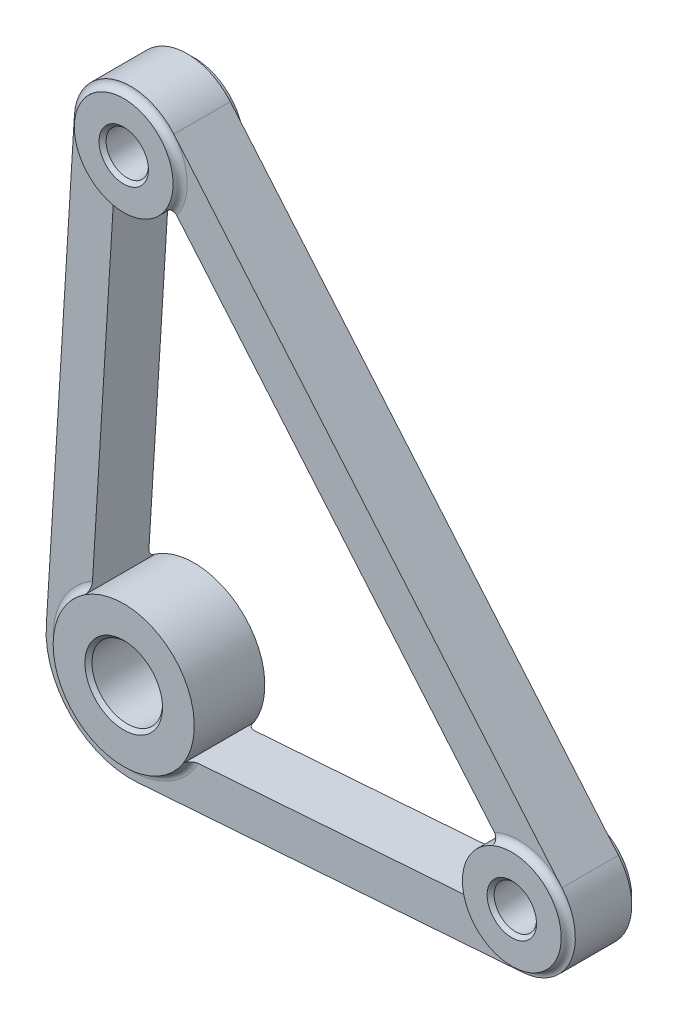
from build123d import *

# Parameters (mm, degrees)
BOSS_EXTRUDE1_DEPTH     = 4
SKETCH2_R               = 10
SKETCH2_R_2             = 7
BOSS_EXTRUDE2_DEPTH     = 1
CUT_EXTRUDE1_DEPTH      = 97.555683416
CUT_EXTRUDE1_DEPTH_BACK = 97.555683416
FILLET4_R               = 1
SKETCH7_R               = 7
SKETCH7_R_2             = 10
BOSS_EXTRUDE4_DEPTH     = 10
CUT_EXTRUDE2_DEPTH      = 97.845237373
CUT_EXTRUDE2_DEPTH_BACK = 97.845237373
SKETCH5_R               = 5
SKETCH5_R_2             = 3
FILLET5_R               = 1
CHAMFER1_SIZE           = 0.5


with BuildPart() as part:
    # Sketch1 → Boss-Extrude1 (new, symmetric)
    with BuildSketch(Plane.XY):
        with BuildLine():
            Line((-11.977256554, 0.738461538), (-7.984837703, 65.492307692))
            ThreePointArc((-7.984837703, 65.492307692), (-2.5191126, 72.593027835), (6.107090283, 70.167537932))
            Line((6.107090283, 70.167537932), (61.107090283, 5.167537932))
            ThreePointArc((61.107090283, 5.167537932), (62.375094743, -3.099673778), (55.581818182, -7.978814925))
            Line((55.581818182, -7.978814925), (0.872727273, -11.968222387))
            ThreePointArc((0.872727273, -11.968222387), (-8.437570547, -8.53272543), (-11.977256554, 0.738461538))
        make_face()
    extrude(amount=BOSS_EXTRUDE1_DEPTH, both=True)

    # Sketch2 → Boss-Extrude2 (add, symmetric)
    with BuildSketch(Plane.XY.offset(4)):
        Circle(SKETCH2_R)
        with Locations((0, 65)):
            Circle(SKETCH2_R_2)
        with Locations((55, 0)):
            Circle(SKETCH2_R_2)
    boss_extrude2 = extrude(amount=BOSS_EXTRUDE2_DEPTH, both=True)

    # Mirror4: Boss-Extrude2 across plane
    add(boss_extrude2.mirror(Plane.XY))

    # Sketch4 → Cut-Extrude1 (cut, two sides: drawn at the far end of the back side and taken through both)
    with BuildSketch(Plane.XY.offset(-CUT_EXTRUDE1_DEPTH_BACK)):
        with BuildLine():
            Line((0.436363636, -5.984111194), (55.145454545, -1.994703731))
            ThreePointArc((55.145454545, -1.994703731), (56.843773686, -0.774918445), (56.526772571, 1.291884483))
            Line((56.526772571, 1.291884483), (1.526772571, 66.291884483))
            ThreePointArc((1.526772571, 66.291884483), (-0.62977815, 66.898256959), (-1.996209426, 65.123076923))
            Line((-1.996209426, 65.123076923), (-5.988628277, 0.369230769))
            ThreePointArc((-5.988628277, 0.369230769), (-4.218785273, -4.266362715), (0.436363636, -5.984111194))
        make_face()
    extrude(amount=CUT_EXTRUDE1_DEPTH + CUT_EXTRUDE1_DEPTH_BACK, mode=Mode.SUBTRACT)

    # Fillet4
    fillet4_edges = [part.edges().sort_by_distance(p)[0] for p in [
        (51.800234692, -2.23863842, 5),
        (54.360216429, 3.852359924, 5),
        (51.800234692, -2.23863842, -5),
        (54.360216429, 3.852359924, -5),
        (-2.2026157, 61.775331943, 5),
        (-2.2026157, 61.775331943, -5),
        (-4.218785273, -4.266362715, 5),
        (-4.218785273, -4.266362715, -5),
        (56.843773686, -0.774918445, 5),
        (56.843773686, -0.774918445, -5),
        (-0.62977815, 66.898256959, 5),
        (-0.62977815, 66.898256959, -5),
        (-5.742474431, 4.361649621, 5),
        (4.425771099, -5.693202103, 5),
        (-5.742474431, 4.361649621, -5),
        (4.425771099, -5.693202103, -5),
        (3.693328713, 63.731409042, 5),
        (3.693328713, 63.731409042, -5),
    ]]
    fillet(fillet4_edges, radius=FILLET4_R)

    # Sketch7 → Boss-Extrude4 (add)
    with BuildSketch(Plane.XY.offset(5)):
        with Locations((0, 65)):
            Circle(SKETCH7_R)
        Circle(SKETCH7_R_2)
        with Locations((55, 0)):
            Circle(SKETCH7_R)
    extrude(amount=-BOSS_EXTRUDE4_DEPTH)

    # Sketch5 → Cut-Extrude2 (cut, two sides: drawn at the far end of the back side and taken through both)
    with BuildSketch(Plane.XY.offset(4).offset(-CUT_EXTRUDE2_DEPTH_BACK)):
        Circle(SKETCH5_R)
        with Locations((55, 0)):
            Circle(SKETCH5_R_2)
        with Locations((0, 65)):
            Circle(SKETCH5_R_2)
    extrude(amount=CUT_EXTRUDE2_DEPTH + CUT_EXTRUDE2_DEPTH_BACK, mode=Mode.SUBTRACT)

    # Fillet5
    # the kernel refuses this fillet: 1 mm, written as the material it adds along each edge
    with BuildSketch(Plane(origin=(0, 0, 4), x_dir=(-0.3253741437230861, 0.9455853565894877, 0), z_dir=(0.9455853565894877, 0.3253741437230861, 0))) as fillet5_piece_1_section:
        with BuildLine():
            CenterArc((10 + FILLET5_R, FILLET5_R), FILLET5_R, 180, 90)
            Line((10 + FILLET5_R, 0), (10, 0))
            Line((10, 0), (10, FILLET5_R))
        make_face()
    fillet5_piece_1 = revolve(axis=Axis((0, 0, 4), (0, 0, 1)), revolution_arc=232.666036755, mode=Mode.PRIVATE)
    fillet5_piece_1 = split(fillet5_piece_1, bisect_by=Plane(origin=(-5.920427429, 1.475394066, 4.281916241), z_dir=(-0.9981047128189905, 0.0615384615384615, 0)), keep=Keep.TOP, mode=Mode.PRIVATE)
    add(fillet5_piece_1)
    with BuildSketch(Plane(origin=(0, 0, 4), x_dir=(-0.3253741437230861, 0.9455853565894877, 0), z_dir=(0.9455853565894877, 0.3253741437230861, 0))) as fillet5_piece_2_section:
        with BuildLine():
            CenterArc((10 + FILLET5_R, FILLET5_R), FILLET5_R, 180, 90)
            Line((10 + FILLET5_R, 0), (10, 0))
            Line((10, 0), (10, FILLET5_R))
        make_face()
    fillet5_piece_2 = revolve(axis=Axis((0, 0, 4), (0, 0, 1)), revolution_arc=232.666036755, mode=Mode.PRIVATE)
    fillet5_piece_2 = split(fillet5_piece_2, bisect_by=Plane(origin=(1.54169258, -5.903510192, 4.281916242), z_dir=(0.0727272727272728, -0.9973518655929074, 0)), keep=Keep.TOP, mode=Mode.PRIVATE)
    add(fillet5_piece_2)
    with BuildSketch(Plane(origin=(0, 0, -4), x_dir=(0.9491746241941357, -0.31474995279732987, 0), z_dir=(0.31474995279732987, 0.9491746241941357, 0))) as fillet5_piece_3_section:
        with BuildLine():
            CenterArc((10 + FILLET5_R, FILLET5_R), FILLET5_R, 180, 90)
            Line((10 + FILLET5_R, 0), (10, 0))
            Line((10, 0), (10, FILLET5_R))
        make_face()
    fillet5_piece_3 = revolve(axis=Axis((0, 0, -4), (0, 0, -1)), revolution_arc=232.666036755, mode=Mode.PRIVATE)
    fillet5_piece_3 = split(fillet5_piece_3, bisect_by=Plane(origin=(1.54169258, -5.903510192, -4.281916242), z_dir=(0.0727272727272728, -0.9973518655929074, 0)), keep=Keep.TOP, mode=Mode.PRIVATE)
    add(fillet5_piece_3)
    with BuildSketch(Plane(origin=(0, 0, -4), x_dir=(0.9491746241941357, -0.31474995279732987, 0), z_dir=(0.31474995279732987, 0.9491746241941357, 0))) as fillet5_piece_4_section:
        with BuildLine():
            CenterArc((10 + FILLET5_R, FILLET5_R), FILLET5_R, 180, 90)
            Line((10 + FILLET5_R, 0), (10, 0))
            Line((10, 0), (10, FILLET5_R))
        make_face()
    fillet5_piece_4 = revolve(axis=Axis((0, 0, -4), (0, 0, -1)), revolution_arc=232.666036755, mode=Mode.PRIVATE)
    fillet5_piece_4 = split(fillet5_piece_4, bisect_by=Plane(origin=(-5.920427429, 1.475394066, -4.281916241), z_dir=(-0.9981047128189905, 0.0615384615384615, 0)), keep=Keep.TOP, mode=Mode.PRIVATE)
    add(fillet5_piece_4)
    with BuildSketch(Plane(origin=(55, 0, -4), x_dir=(-0.6968311842532597, 0.7172351780637922, 0), z_dir=(-0.7172351780637922, -0.6968311842532597, 0))) as fillet5_piece_5_section:
        with BuildLine():
            CenterArc((7 + FILLET5_R, FILLET5_R), FILLET5_R, 180, 90)
            Line((7 + FILLET5_R, 0), (7, 0))
            Line((7, 0), (7, FILLET5_R))
        make_face()
    fillet5_piece_5 = revolve(axis=Axis((55, 0, -4), (0, 0, -1)), revolution_arc=313.939632046, mode=Mode.PRIVATE)
    fillet5_piece_5 = split(fillet5_piece_5, bisect_by=Plane(origin=(55.594787513, 2.39332137, -4.282249328), z_dir=(0.7633862853691147, 0.6459422414661737, 0)), keep=Keep.TOP, mode=Mode.PRIVATE)
    add(fillet5_piece_5)
    with BuildSketch(Plane(origin=(55, 0, -4), x_dir=(-0.6968311842532597, 0.7172351780637922, 0), z_dir=(-0.7172351780637922, -0.6968311842532597, 0))) as fillet5_piece_6_section:
        with BuildLine():
            CenterArc((7 + FILLET5_R, FILLET5_R), FILLET5_R, 180, 90)
            Line((7 + FILLET5_R, 0), (7, 0))
            Line((7, 0), (7, FILLET5_R))
        make_face()
    fillet5_piece_6 = revolve(axis=Axis((55, 0, -4), (0, 0, -1)), revolution_arc=313.939632046, mode=Mode.PRIVATE)
    fillet5_piece_6 = split(fillet5_piece_6, bisect_by=Plane(origin=(53.706445023, -2.099636846, -4.282249327), z_dir=(0.0727272727272728, -0.9973518655929074, 0)), keep=Keep.TOP, mode=Mode.PRIVATE)
    add(fillet5_piece_6)
    with BuildSketch(Plane(origin=(0, 65, -4), x_dir=(0.0072361398734146105, -0.9999738187971385, 0), z_dir=(0.9999738187971385, 0.0072361398734146105, 0))) as fillet5_piece_7_section:
        with BuildLine():
            CenterArc((7 + FILLET5_R, FILLET5_R), FILLET5_R, 180, 90)
            Line((7 + FILLET5_R, 0), (7, 0))
            Line((7, 0), (7, FILLET5_R))
        make_face()
    fillet5_piece_7 = revolve(axis=Axis((0, 65, -4), (0, 0, -1)), revolution_arc=324.120972818, mode=Mode.PRIVATE)
    fillet5_piece_7 = split(fillet5_piece_7, bisect_by=Plane(origin=(-2.045715715, 64.320124436, -4.281970482), z_dir=(-0.9981047128189905, 0.0615384615384615, 0)), keep=Keep.TOP, mode=Mode.PRIVATE)
    add(fillet5_piece_7)
    with BuildSketch(Plane(origin=(0, 65, -4), x_dir=(0.0072361398734146105, -0.9999738187971385, 0), z_dir=(0.9999738187971385, 0.0072361398734146105, 0))) as fillet5_piece_8_section:
        with BuildLine():
            CenterArc((7 + FILLET5_R, FILLET5_R), FILLET5_R, 180, 90)
            Line((7 + FILLET5_R, 0), (7, 0))
            Line((7, 0), (7, FILLET5_R))
        make_face()
    fillet5_piece_8 = revolve(axis=Axis((0, 65, -4), (0, 0, -1)), revolution_arc=324.120972818, mode=Mode.PRIVATE)
    fillet5_piece_8 = split(fillet5_piece_8, bisect_by=Plane(origin=(2.046418378, 65.67775762, -4.281970481), z_dir=(0.7633862853691147, 0.6459422414661737, 0)), keep=Keep.TOP, mode=Mode.PRIVATE)
    add(fillet5_piece_8)
    with BuildSketch(Plane(origin=(55, 0, 4), x_dir=(-0.696831184253259, 0.7172351780637929, 0), z_dir=(-0.7172351780637929, -0.696831184253259, 0))) as fillet5_piece_9_section:
        with BuildLine():
            CenterArc((7 + FILLET5_R, -FILLET5_R), FILLET5_R, 90, 90)
            Line((7 + FILLET5_R, 0), (7, 0))
            Line((7, 0), (7, -FILLET5_R))
        make_face()
    fillet5_piece_9 = revolve(axis=Axis((55, 0, 4), (0, 0, -1)), revolution_arc=313.939632046, mode=Mode.PRIVATE)
    fillet5_piece_9 = split(fillet5_piece_9, bisect_by=Plane(origin=(55.594787513, 2.39332137, 4.282249328), z_dir=(0.7633862853691147, 0.6459422414661737, 0)), keep=Keep.TOP, mode=Mode.PRIVATE)
    add(fillet5_piece_9)
    with BuildSketch(Plane(origin=(55, 0, 4), x_dir=(-0.696831184253259, 0.7172351780637929, 0), z_dir=(-0.7172351780637929, -0.696831184253259, 0))) as fillet5_piece_10_section:
        with BuildLine():
            CenterArc((7 + FILLET5_R, -FILLET5_R), FILLET5_R, 90, 90)
            Line((7 + FILLET5_R, 0), (7, 0))
            Line((7, 0), (7, -FILLET5_R))
        make_face()
    fillet5_piece_10 = revolve(axis=Axis((55, 0, 4), (0, 0, -1)), revolution_arc=313.939632046, mode=Mode.PRIVATE)
    fillet5_piece_10 = split(fillet5_piece_10, bisect_by=Plane(origin=(53.706445023, -2.099636846, 4.282249327), z_dir=(0.0727272727272728, -0.9973518655929074, 0)), keep=Keep.TOP, mode=Mode.PRIVATE)
    add(fillet5_piece_10)
    with BuildSketch(Plane(origin=(0, 65, 4), x_dir=(0.0072361398734146105, -0.9999738187971385, 0), z_dir=(0.9999738187971385, 0.0072361398734146105, 0))) as fillet5_piece_11_section:
        with BuildLine():
            CenterArc((7 + FILLET5_R, -FILLET5_R), FILLET5_R, 90, 90)
            Line((7 + FILLET5_R, 0), (7, 0))
            Line((7, 0), (7, -FILLET5_R))
        make_face()
    fillet5_piece_11 = revolve(axis=Axis((0, 65, 4), (0, 0, -1)), revolution_arc=324.120972818, mode=Mode.PRIVATE)
    fillet5_piece_11 = split(fillet5_piece_11, bisect_by=Plane(origin=(-2.045715715, 64.320124436, 4.281970482), z_dir=(-0.9981047128189905, 0.0615384615384615, 0)), keep=Keep.TOP, mode=Mode.PRIVATE)
    add(fillet5_piece_11)
    with BuildSketch(Plane(origin=(0, 65, 4), x_dir=(0.0072361398734146105, -0.9999738187971385, 0), z_dir=(0.9999738187971385, 0.0072361398734146105, 0))) as fillet5_piece_12_section:
        with BuildLine():
            CenterArc((7 + FILLET5_R, -FILLET5_R), FILLET5_R, 90, 90)
            Line((7 + FILLET5_R, 0), (7, 0))
            Line((7, 0), (7, -FILLET5_R))
        make_face()
    fillet5_piece_12 = revolve(axis=Axis((0, 65, 4), (0, 0, -1)), revolution_arc=324.120972818, mode=Mode.PRIVATE)
    fillet5_piece_12 = split(fillet5_piece_12, bisect_by=Plane(origin=(2.046418378, 65.67775762, 4.281970481), z_dir=(0.7633862853691147, 0.6459422414661737, 0)), keep=Keep.TOP, mode=Mode.PRIVATE)
    add(fillet5_piece_12)

    # Chamfer1
    chamfer1_edges = [part.edges().sort_by_distance(p)[0] for p in [
        (-3, 65, -5),
        (-3, 65, 5),
        (52, 0, -5),
        (52, 0, 5),
        (-5, 0, -5),
        (-5, 0, 5),
    ]]
    chamfer(chamfer1_edges, length=CHAMFER1_SIZE)


solid = part.part
